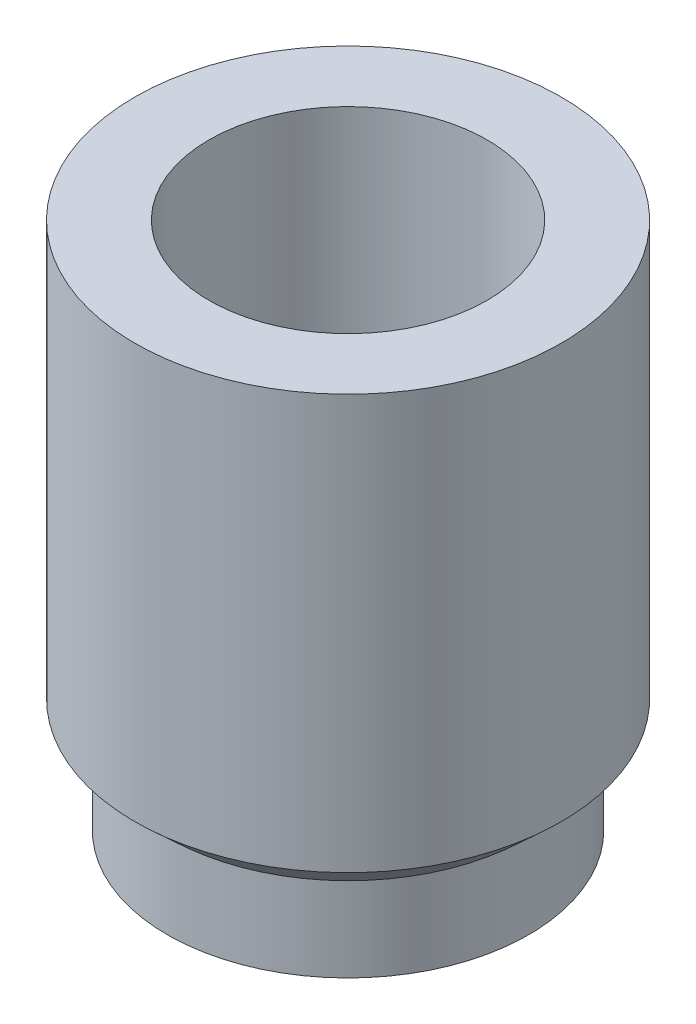
from build123d import *

# Parameters (mm, degrees)
CUT_EXTRUDE1_DEPTH      = 7.562773804
CUT_EXTRUDE1_DEPTH_BACK = 7.562773804
SKETCH2_R               = 1.5


with BuildPart() as part:
    # Sketch1 → Revolve1 (revolve)
    with BuildSketch(Plane.XY):
        Polygon((0, 0), (1.95, 0), (1.95, 0.90826831), (2.3, 1.231343027), (2.3, 5.7), (0, 5.7), align=None)
    revolve(axis=Axis((0, 5.7, 0), (0, -1, 0)))

    # Sketch2 → Cut-Extrude1 (cut, two sides: drawn at the far end of the back side and taken through both)
    with BuildSketch(Plane(origin=(0, 5.7, 0), x_dir=(1, 0, 0), z_dir=(0, 1, 0)).offset(-CUT_EXTRUDE1_DEPTH_BACK)):
        Circle(SKETCH2_R)
    extrude(amount=CUT_EXTRUDE1_DEPTH + CUT_EXTRUDE1_DEPTH_BACK, mode=Mode.SUBTRACT)


solid = part.part
